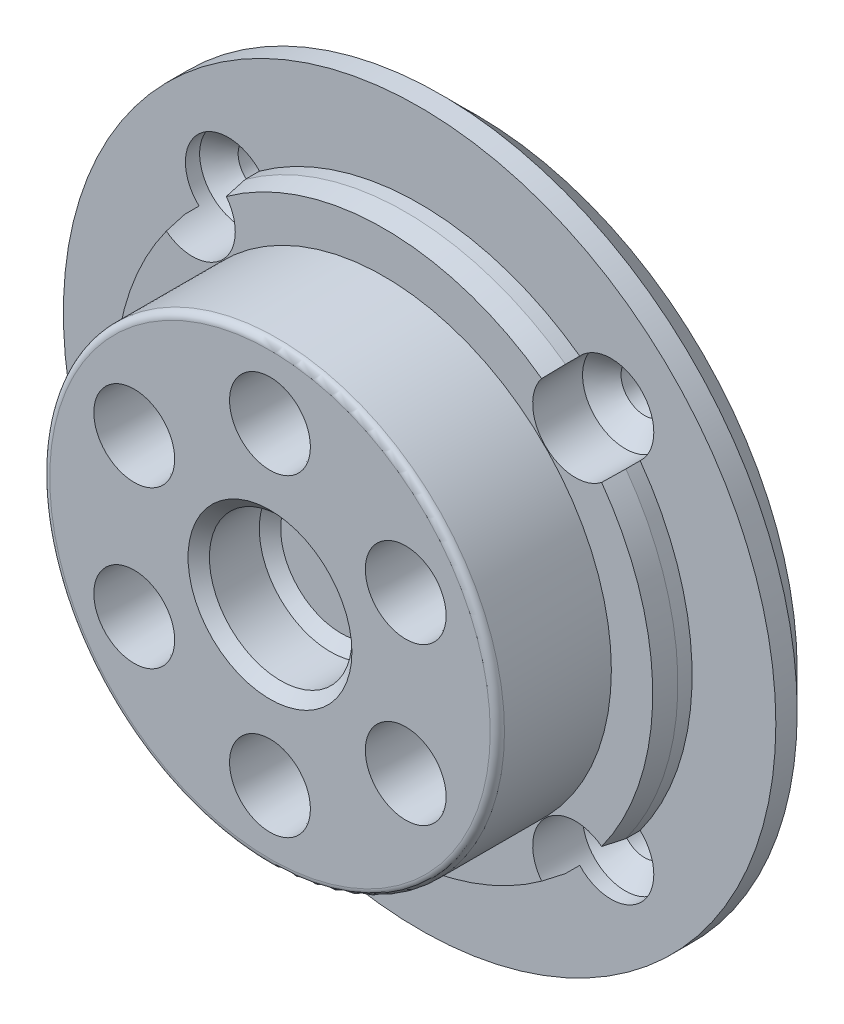
from build123d import *
from OCP.BRepFilletAPI import BRepFilletAPI_MakeChamfer

# Parameters (mm, degrees)
SKETCH1_R               = 25
BOSS_EXTRUDE1_DEPTH     = 4
SKETCH2_R               = 19.125
BOSS_EXTRUDE2_DEPTH     = 2.5
SKETCH3_R               = 15.9575
BOSS_EXTRUDE3_DEPTH     = 8
SKETCH4_R               = 2.5
CUT_EXTRUDE1_DEPTH      = 3
SKETCH7_R               = 2.5
CUT_EXTRUDE3_DEPTH      = 11
SKETCH8_R               = 5
CUT_EXTRUDE4_DEPTH      = 4
CHAMFER1_SIZE           = 2.5
FILLET1_R               = 0.5
CUT_EXTRUDE7_DEPTH      = 37.881567212
CUT_EXTRUDE7_DEPTH_BACK = 37.881567212
SKETCH11_R              = 1.65
SKETCH12_R              = 3
CUT_EXTRUDE8_DEPTH      = 5
CUT_EXTRUDE11_START     = -5
SKETCH15_R              = 5
CUT_EXTRUDE11_DEPTH     = 5
CHAMFER2_SIZE           = 1.5
FILLET2_R               = 2
CHAMFER3_SIZE           = 1.5
CHAMFER3_SIZE2          = 0.264490471
CHAMFER4_SIZE           = 0.75
CHAMFER5_SIZE           = 0.75
SKETCH16_R              = 0.75
CUT_EXTRUDE12_DEPTH     = 38.027017163
CHAMFER6_SIZE           = 0.4
DRAFT1_ANGLE            = 1.75
DRAFT2_ANGLE            = 1


with BuildPart() as part:
    # Sketch1 → Boss-Extrude1 (new body)
    with BuildSketch(Plane.XY):
        Circle(SKETCH1_R)
    extrude(amount=BOSS_EXTRUDE1_DEPTH)

    # Sketch2 → Boss-Extrude2 (add)
    with BuildSketch(Plane.XY.offset(4)):
        Circle(SKETCH2_R)
    extrude(amount=BOSS_EXTRUDE2_DEPTH)

    # Sketch3 → Boss-Extrude3 (add)
    with BuildSketch(Plane.XY.offset(6.5)):
        Circle(SKETCH3_R)
    extrude(amount=BOSS_EXTRUDE3_DEPTH)

    # Sketch4 → Cut-Extrude1 (cut)
    with BuildSketch(Plane(origin=(0, 0, 0), x_dir=(-1, 0, 0), z_dir=(0, 0, -1))):
        with Locations((0, 16.93333)):
            Circle(SKETCH4_R)
        with Locations((16.93333, 0)):
            Circle(SKETCH4_R)
        with Locations((0, -16.93333)):
            Circle(SKETCH4_R)
        with Locations((-16.93333, 0)):
            Circle(SKETCH4_R)
    extrude(amount=-CUT_EXTRUDE1_DEPTH, mode=Mode.SUBTRACT)

    # Sketch7 → Cut-Extrude3 (cut)
    with BuildSketch(Plane.XY.offset(14.5)):
        with Locations((0, 11)):
            Circle(SKETCH7_R)
        with Locations((9.526279442, 5.5)):
            Circle(SKETCH7_R)
        with Locations((9.526279442, -5.5)):
            Circle(SKETCH7_R)
        with Locations((0, -11)):
            Circle(SKETCH7_R)
        with Locations((-9.526279442, -5.5)):
            Circle(SKETCH7_R)
        with Locations((-9.526279442, 5.5)):
            Circle(SKETCH7_R)
    extrude(amount=-CUT_EXTRUDE3_DEPTH, mode=Mode.SUBTRACT)

    # Sketch8 → Cut-Extrude4 (cut)
    with BuildSketch(Plane(origin=(0, 0, 0), x_dir=(-1, 0, 0), z_dir=(0, 0, -1))):
        Circle(SKETCH8_R)
    extrude(amount=-CUT_EXTRUDE4_DEPTH, mode=Mode.SUBTRACT)

    # Chamfer1
    chamfer1_edges = [part.edges().sort_by_distance(p)[0] for p in [
        (-25, 0, 0),
    ]]
    chamfer(chamfer1_edges, length=CHAMFER1_SIZE)

    # Fillet1
    fillet1_edges = [part.edges().sort_by_distance(p)[0] for p in [
        (-15.9575, 0, 14.5),
    ]]
    fillet(fillet1_edges, radius=FILLET1_R)

    # Sketch11 → Cut-Extrude7 (cut, two sides: drawn at the far end of the back side and taken through both)
    with BuildSketch(Plane.XY.offset(4).offset(-CUT_EXTRUDE7_DEPTH_BACK)):
        with Locations((-13.435028843, 13.435028843)):
            Circle(SKETCH11_R)
        with Locations((13.435028843, 13.435028843)):
            Circle(SKETCH11_R)
        with Locations((13.435028843, -13.435028843)):
            Circle(SKETCH11_R)
        with Locations((-13.435028843, -13.435028843)):
            Circle(SKETCH11_R)
    extrude(amount=CUT_EXTRUDE7_DEPTH + CUT_EXTRUDE7_DEPTH_BACK, mode=Mode.SUBTRACT)

    # Sketch12 → Cut-Extrude8 (cut)
    with BuildSketch(Plane.XY.offset(6.5)):
        with Locations((-13.435028843, 13.435028843)):
            Circle(SKETCH12_R)
        with Locations((13.435028843, 13.435028843)):
            Circle(SKETCH12_R)
        with Locations((13.435028843, -13.435028843)):
            Circle(SKETCH12_R)
        with Locations((-13.435028843, -13.435028843)):
            Circle(SKETCH12_R)
    extrude(amount=-CUT_EXTRUDE8_DEPTH, mode=Mode.SUBTRACT)

    # Sketch15 → Cut-Extrude11 (cut)
    with BuildSketch(Plane.XY.offset(14.5).offset(CUT_EXTRUDE11_START)):
        with Locations(Location((0, 0, 0), (0, 0, 180))):
            Circle(SKETCH15_R)
    extrude(amount=CUT_EXTRUDE11_DEPTH, mode=Mode.SUBTRACT)

    # Chamfer2
    # the kernel refuses this chamfer: 1.5 mm, written as the material it adds along each edge
    with BuildSketch(Plane(origin=(13.435028843, -13.435028843, 1.5), x_dir=(1, 0, 0), z_dir=(0, -1, 0))) as chamfer2_piece_1_section:
        Polygon((3, CHAMFER2_SIZE), (3 - CHAMFER2_SIZE, 0), (3, 0), align=None)
    chamfer2_piece_1 = revolve(axis=Axis((13.435028843, -13.435028843, 1.5), (0, 0, 1)), mode=Mode.PRIVATE)
    chamfer2_piece_1 = chamfer2_piece_1 - Plane(origin=(13.435028843, -13.435028843, 2.327258636), x_dir=(1, 0, 0), z_dir=(0, 0, 1)) * Cylinder(1.65, 13, mode=Mode.PRIVATE)
    add(chamfer2_piece_1)
    with BuildSketch(Plane(origin=(-13.435028843, -13.435028843, 1.5), x_dir=(1, 0, 0), z_dir=(0, -1, 0))) as chamfer2_piece_2_section:
        Polygon((3, CHAMFER2_SIZE), (3 - CHAMFER2_SIZE, 0), (3, 0), align=None)
    chamfer2_piece_2 = revolve(axis=Axis((-13.435028843, -13.435028843, 1.5), (0, 0, 1)), mode=Mode.PRIVATE)
    chamfer2_piece_2 = chamfer2_piece_2 - Plane(origin=(-13.435028843, -13.435028843, 2.327258636), x_dir=(1, 0, 0), z_dir=(0, 0, 1)) * Cylinder(1.65, 12, mode=Mode.PRIVATE)
    add(chamfer2_piece_2)
    with BuildSketch(Plane(origin=(13.435028843, 13.435028843, 1.5), x_dir=(1, 0, 0), z_dir=(0, -1, 0))) as chamfer2_piece_3_section:
        Polygon((3, CHAMFER2_SIZE), (3 - CHAMFER2_SIZE, 0), (3, 0), align=None)
    chamfer2_piece_3 = revolve(axis=Axis((13.435028843, 13.435028843, 1.5), (0, 0, 1)), mode=Mode.PRIVATE)
    chamfer2_piece_3 = chamfer2_piece_3 - Plane(origin=(13.435028843, 13.435028843, 2.327258636), x_dir=(1, 0, 0), z_dir=(0, 0, 1)) * Cylinder(1.65, 13, mode=Mode.PRIVATE)
    add(chamfer2_piece_3)
    with BuildSketch(Plane(origin=(-13.435028843, 13.435028843, 1.5), x_dir=(1, 0, 0), z_dir=(0, -1, 0))) as chamfer2_piece_4_section:
        Polygon((3, CHAMFER2_SIZE), (3 - CHAMFER2_SIZE, 0), (3, 0), align=None)
    chamfer2_piece_4 = revolve(axis=Axis((-13.435028843, 13.435028843, 1.5), (0, 0, 1)), mode=Mode.PRIVATE)
    chamfer2_piece_4 = chamfer2_piece_4 - Plane(origin=(-13.435028843, 13.435028843, 2.327258636), x_dir=(1, 0, 0), z_dir=(0, 0, 1)) * Cylinder(1.65, 13, mode=Mode.PRIVATE)
    add(chamfer2_piece_4)

    # Fillet2
    fillet2_edges = [part.edges().sort_by_distance(p)[0] for p in [
        (5, 0, 4),
    ]]
    fillet(fillet2_edges, radius=FILLET2_R)

    # Chamfer3: one chamfer whose edges measure the first distance from different faces: ONE call of the kernel's chamfer builder (chamfer() names one face for all edges)
    chamfer3_edges_1 = [part.edges().sort_by_distance(p)[0] for p in [
        (0, -19.125, 6.5),
    ]]
    chamfer3_side_1 = [part.faces().sort_by_distance(p)[0] for p in [
        (0, -19.125, 5.25),
    ]]
    chamfer3_edges_2 = [part.edges().sort_by_distance(p)[0] for p in [
        (19.125, 0, 6.5),
    ]]
    chamfer3_side_2 = [part.faces().sort_by_distance(p)[0] for p in [
        (19.125, 0, 5.25),
    ]]
    chamfer3_edges_3 = [part.edges().sort_by_distance(p)[0] for p in [
        (0, 19.125, 6.5),
    ]]
    chamfer3_side_3 = [part.faces().sort_by_distance(p)[0] for p in [
        (0, 19.125, 5.25),
    ]]
    chamfer3_edges_4 = [part.edges().sort_by_distance(p)[0] for p in [
        (-19.125, 0, 6.5),
    ]]
    chamfer3_side_4 = [part.faces().sort_by_distance(p)[0] for p in [
        (-19.125, 0, 5.25),
    ]]
    chamfer3 = BRepFilletAPI_MakeChamfer(part.part.solid().wrapped)
    for e in chamfer3_edges_1:
        chamfer3.Add(CHAMFER3_SIZE, CHAMFER3_SIZE2, e.wrapped, chamfer3_side_1[0].wrapped)  # the first distance lies on this face
    for e in chamfer3_edges_2:
        chamfer3.Add(CHAMFER3_SIZE, CHAMFER3_SIZE2, e.wrapped, chamfer3_side_2[0].wrapped)  # the first distance lies on this face
    for e in chamfer3_edges_3:
        chamfer3.Add(CHAMFER3_SIZE, CHAMFER3_SIZE2, e.wrapped, chamfer3_side_3[0].wrapped)  # the first distance lies on this face
    for e in chamfer3_edges_4:
        chamfer3.Add(CHAMFER3_SIZE, CHAMFER3_SIZE2, e.wrapped, chamfer3_side_4[0].wrapped)  # the first distance lies on this face
    add(Compound.cast(chamfer3.Shape()), mode=Mode.REPLACE)

    # Chamfer4
    chamfer4_edges = [part.edges().sort_by_distance(p)[0] for p in [
        (5, 0, 9.5),
    ]]
    chamfer(chamfer4_edges, length=CHAMFER4_SIZE)

    # Chamfer5
    chamfer5_edges = [part.edges().sort_by_distance(p)[0] for p in [
        (5, 0, 14.5),
    ]]
    chamfer(chamfer5_edges, length=CHAMFER5_SIZE)

    # Sketch16 → Cut-Extrude12 (cut, through all)
    with BuildSketch(Plane.XY.offset(3.5)):
        with Locations((-9.526279442, -5.5)):
            Circle(SKETCH16_R)
        with Locations((-9.526279442, 5.5)):
            Circle(SKETCH16_R)
        with Locations((0, 11)):
            Circle(SKETCH16_R)
        with Locations((9.526279442, 5.5)):
            Circle(SKETCH16_R)
        with Locations((9.526279442, -5.5)):
            Circle(SKETCH16_R)
        with Locations((0, -11)):
            Circle(SKETCH16_R)
    extrude(amount=-CUT_EXTRUDE12_DEPTH, mode=Mode.SUBTRACT)

    # Chamfer6
    chamfer6_edges = [part.edges().sort_by_distance(p)[0] for p in [
        (2.5, 16.93333, 0),
        (-14.43333, 0, 0),
        (2.5, -16.93333, 0),
        (19.43333, 0, 0),
    ]]
    chamfer(chamfer6_edges, length=CHAMFER6_SIZE)

    # Draft1
    draft1_faces = [part.faces().sort_by_distance(p)[0] for p in [
        (7.026279442, 5.5, 9),
        (-2.5, 11, 9),
        (-12.026279442, 5.5, 9),
        (-12.026279442, -5.5, 9),
        (-2.5, -11, 9),
        (7.026279442, -5.5, 9),
    ]]
    draft(draft1_faces, Plane(origin=(9.526279442, -5.5, 3.5), x_dir=(1, 0, 0), z_dir=(0, 0, 1)), DRAFT1_ANGLE)

    # Draft2
    draft2_faces = [part.faces().sort_by_distance(p)[0] for p in [
        (2.5, -16.93333, 1.7),
        (-14.43333, 0, 1.7),
        (19.43333, 0, 1.7),
        (2.5, 16.93333, 1.7),
    ]]
    draft(draft2_faces, Plane(origin=(0, 16.93333, 3), x_dir=(-1, 0, 0), z_dir=(0, 0, -1)), DRAFT2_ANGLE)


solid = part.part
